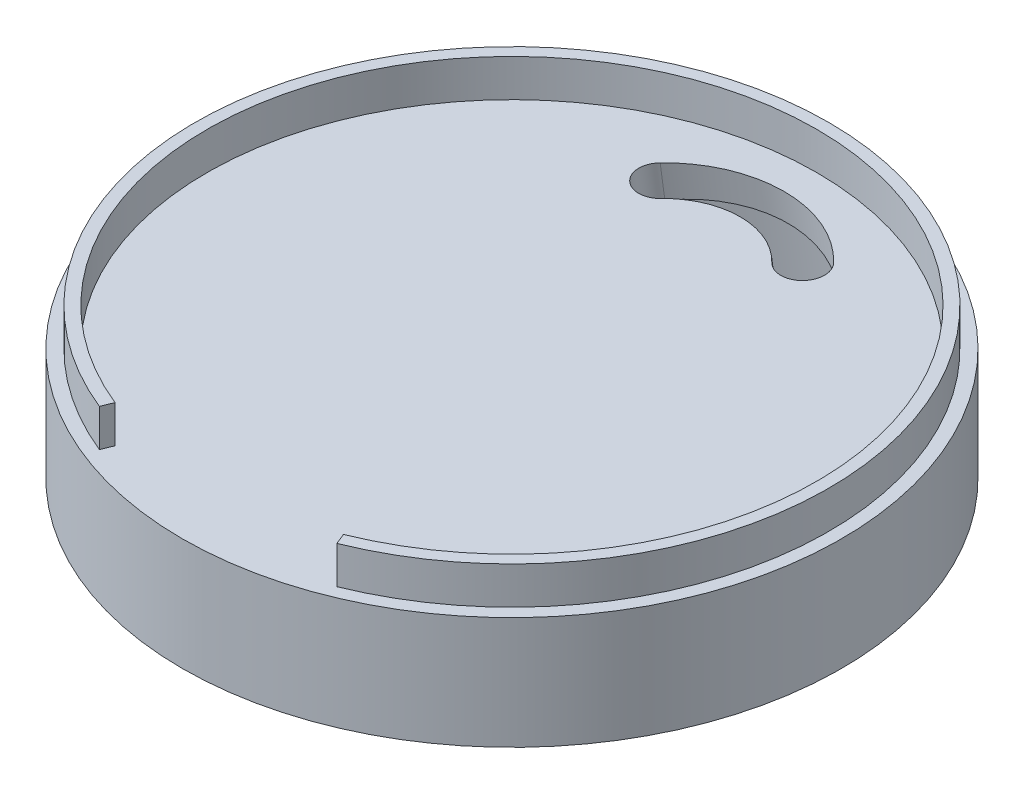
from build123d import *

# Parameters (mm, degrees)
SKETCH1_R           = 44
BOSS_EXTRUDE1_DEPTH = 15
BOSS_EXTRUDE2_DEPTH = 5
SKETCH5_R           = 40
CUT_EXTRUDE1_DEPTH  = 20
CUT_EXTRUDE2_DEPTH  = 10
SKETCH7_R           = 3
CUT_EXTRUDE3_DEPTH  = 3
FILLET4_R           = 1


with BuildPart() as part:
    # Sketch1 → Boss-Extrude1 (new body)
    with BuildSketch(Plane(origin=(0, 0, 0), x_dir=(1, 0, 0), z_dir=(0, 1, 0))):
        with Locations(Location((0, 0, 0), (0, 0, 270))):
            Circle(SKETCH1_R)
    extrude(amount=BOSS_EXTRUDE1_DEPTH)

    # Sketch2 → Boss-Extrude2 (add)
    with BuildSketch(Plane(origin=(0, 15, 0), x_dir=(1, 0, 0), z_dir=(0, 1, 0))):
        with BuildLine():
            Line((15.246488352, -37.736382881), (15.845858901, -39.219877048))
            ThreePointArc((15.845858901, -39.219877048), (0, 42.3), (-15.845858901, -39.219877048))
            Line((-15.845858901, -39.219877048), (-15.246488352, -37.736382881))
            ThreePointArc((-15.246488352, -37.736382881), (0, 40.7), (15.246488352, -37.736382881))
        make_face()
    extrude(amount=BOSS_EXTRUDE2_DEPTH)

    # Sketch5 → Cut-Extrude1 (cut)
    with BuildSketch(Plane(origin=(0, 5.890466531, 0.803245436), x_dir=(-1, 0, 0), z_dir=(0, -0.990830168044299, -0.13511320473331362))):
        with Locations(Location((0, 0, 0), (0, 0, 270))):
            Circle(SKETCH5_R)
    extrude(amount=CUT_EXTRUDE1_DEPTH, mode=Mode.SUBTRACT)

    # Sketch6 → Cut-Extrude2 (cut)
    with BuildSketch(Plane(origin=(0, 5.890466531, 0.803245436), x_dir=(1, 0, 0), z_dir=(0, -0.990830168044299, -0.13511320473331365))):
        with BuildLine():
            ThreePointArc((-11.581105416, -33.107376853), (0, -38.033026978), (11.581105416, -33.107376853))
            ThreePointArc((11.581105416, -33.107376853), (11.503519007, -28.998721657), (7.39486381, -29.076308066))
            ThreePointArc((7.39486381, -29.076308066), (0, -32.221475176), (-7.39486381, -29.076308066))
            ThreePointArc((-7.39486381, -29.076308066), (-11.503519007, -28.998721657), (-11.581105416, -33.107376853))
        make_face()
    extrude(amount=-CUT_EXTRUDE2_DEPTH, mode=Mode.SUBTRACT)

    # Sketch7 → Cut-Extrude3 (cut)
    with BuildSketch(Plane(origin=(0, 6.082528488, -0.605208909), x_dir=(1, 0, 0), z_dir=(0, 0.990830168044299, 0.13511320473331365))):
        with Locations(Location((14.370787869, -14.421489162, 0), (0, 0, 270))):
            Circle(SKETCH7_R)
        with Locations(Location((-14.370787869, -14.421489162, 0), (0, 0, 90))):
            Circle(SKETCH7_R)
    extrude(amount=CUT_EXTRUDE3_DEPTH, mode=Mode.SUBTRACT)

    # Fillet4
    # the kernel refuses this fillet: 1 mm, written as the material it adds along each edge
    with BuildSketch(Plane(origin=(0, 5.890466531, 0.803245436), x_dir=(0, -0.13511320473331362, 0.9908301680442989), z_dir=(1, 0, 0))) as fillet4_piece_1_section:
        with BuildLine():
            CenterArc((40 - FILLET4_R, FILLET4_R), FILLET4_R, 270, 90)
            Line((40 - FILLET4_R, 0), (40, 0))
            Line((40, 0), (40, FILLET4_R))
        make_face()
    fillet4_piece_1 = revolve(axis=Axis((0, 5.890466531, 0.803245436), (0, -0.990830168044299, -0.13511320473331362)), mode=Mode.PRIVATE)
    fillet4_piece_1 = split(fillet4_piece_1, bisect_by=Plane(origin=(0, 0, -38.603422622), z_dir=(0, 1, 0)), keep=Keep.TOP, mode=Mode.PRIVATE)
    add(fillet4_piece_1)

    # Sketch9 → Revolve4 (revolve)
    with BuildSketch(Plane(origin=(0, 0, 0), x_dir=(1, 0, 0), z_dir=(0, 0.13511320473331362, -0.990830168044299)), mode=Mode.PRIVATE) as revolve4_sk:
        with BuildLine():
            Line((0, 4.055018992), (0, -5.944981008))
            Line((0, -5.944981008), (4.472135955, -5.944981008))
            ThreePointArc((4.472135955, -5.944981008), (5.477225575, 0.504508735), (0, 4.055018992))
        make_face()
    revolve(revolve4_sk.sketch.rotate(Axis((0, -4.017835149, -0.547886611), (0, 0.9908301680442989, 0.1351132047333136)), 90), axis=Axis((0, -4.017835149, -0.547886611), (0, 0.9908301680442989, 0.1351132047333136)))


solid = part.part
